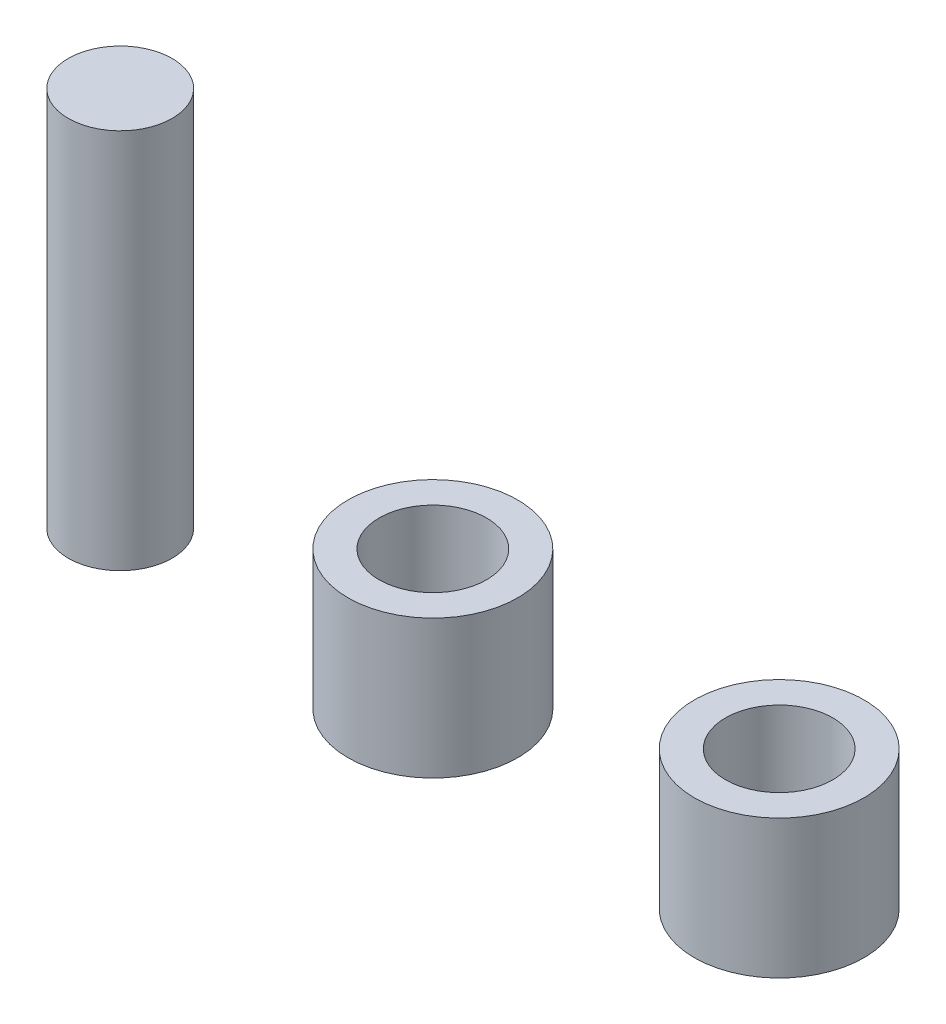
from build123d import *

# Parameters (mm, degrees)
SKETCH1_R           = 2.45
BOSS_EXTRUDE1_DEPTH = 4
SKETCH2_R           = 1.5
BOSS_EXTRUDE2_DEPTH = 11
SKETCH4_R           = 1.55
CUT_EXTRUDE1_DEPTH  = 3


with BuildPart() as part:
    # Sketch1 → Boss-Extrude1 (new body)
    with BuildSketch(Plane(origin=(0, 0, 0), x_dir=(1, 0, 0), z_dir=(0, 1, 0))):
        Circle(SKETCH1_R)
    extrude(amount=BOSS_EXTRUDE1_DEPTH)

    # Sketch4 → Cut-Extrude1 (cut)
    with BuildSketch(Plane(origin=(0, 4, 0), x_dir=(1, 0, 0), z_dir=(0, 1, 0))):
        Circle(SKETCH4_R)
    extrude(amount=-CUT_EXTRUDE1_DEPTH, mode=Mode.SUBTRACT)


with BuildPart() as body_2:
    # Sketch2 → Boss-Extrude2 (new body)
    with BuildSketch(Plane(origin=(0, 0, 0), x_dir=(1, 0, 0), z_dir=(0, 1, 0))):
        with Locations((-9.027296586, 0)):
            Circle(SKETCH2_R)
    extrude(amount=BOSS_EXTRUDE2_DEPTH)


with BuildPart() as body_3:
    # Mirror1: mirrored copy
    add(part.part.mirror(Plane(origin=(5, 0, 0), x_dir=(0, 0, 1), z_dir=(1, 0, 0))))


solid = Compound([part.part, body_2.part, body_3.part])
